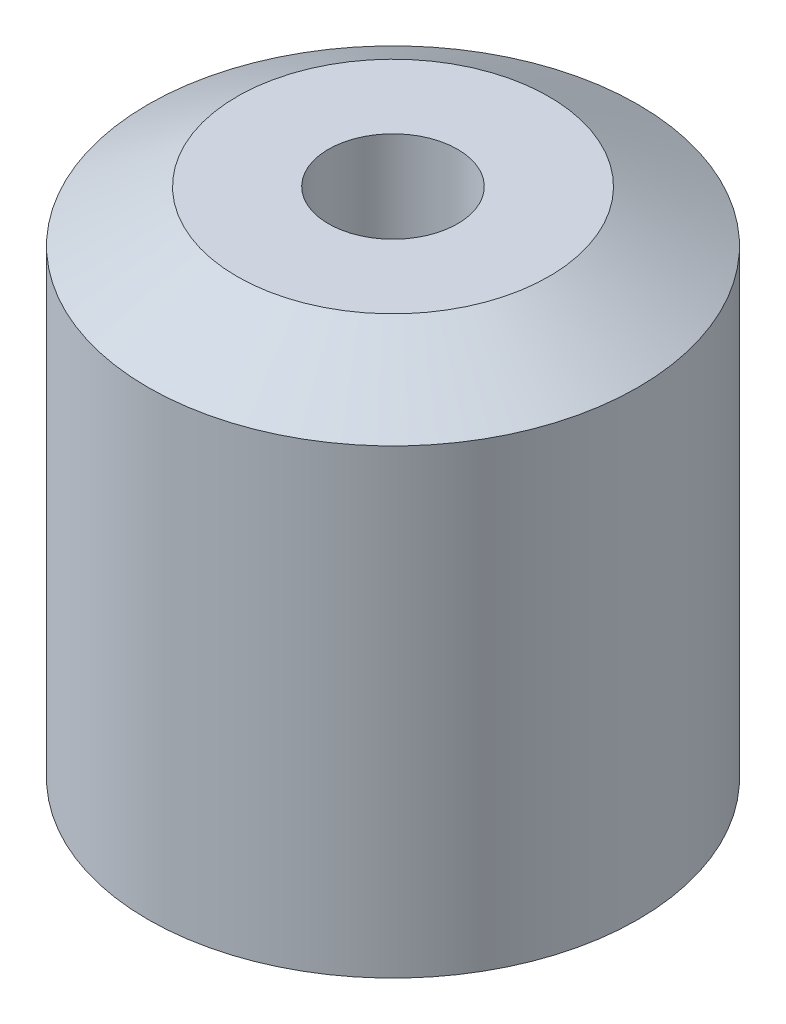
from build123d import *

# Parameters (mm, degrees)
CBORE_FOR_M2_5_SHCS1_D           = 2.9
CBORE_FOR_M2_5_SHCS1_CBORE_D     = 5.5
CBORE_FOR_M2_5_SHCS1_CBORE_DEPTH = 2.5


with BuildPart() as part:
    # Sketch1 → Revolve1 (revolve)
    with BuildSketch(Plane(origin=(0, 0, 0), x_dir=(0, 0, -1), z_dir=(1, 0, 0))):
        Polygon((-5.5, 10.345299462), (-5.5, 0), (0, 0), (0, 11.5), (-3.5, 11.5), align=None)
    revolve(axis=Axis((0, 11.5, 0), (0, -1, 0)))

    # CBORE for M2.5 SHCS1 (through all)
    with Locations(Plane(origin=(0, 0, 0), x_dir=(-1, 0, 0), z_dir=(0, -1, 0))):
        with Locations((0, 0)):
            CounterBoreHole(CBORE_FOR_M2_5_SHCS1_D / 2, CBORE_FOR_M2_5_SHCS1_CBORE_D / 2, CBORE_FOR_M2_5_SHCS1_CBORE_DEPTH)


solid = part.part
